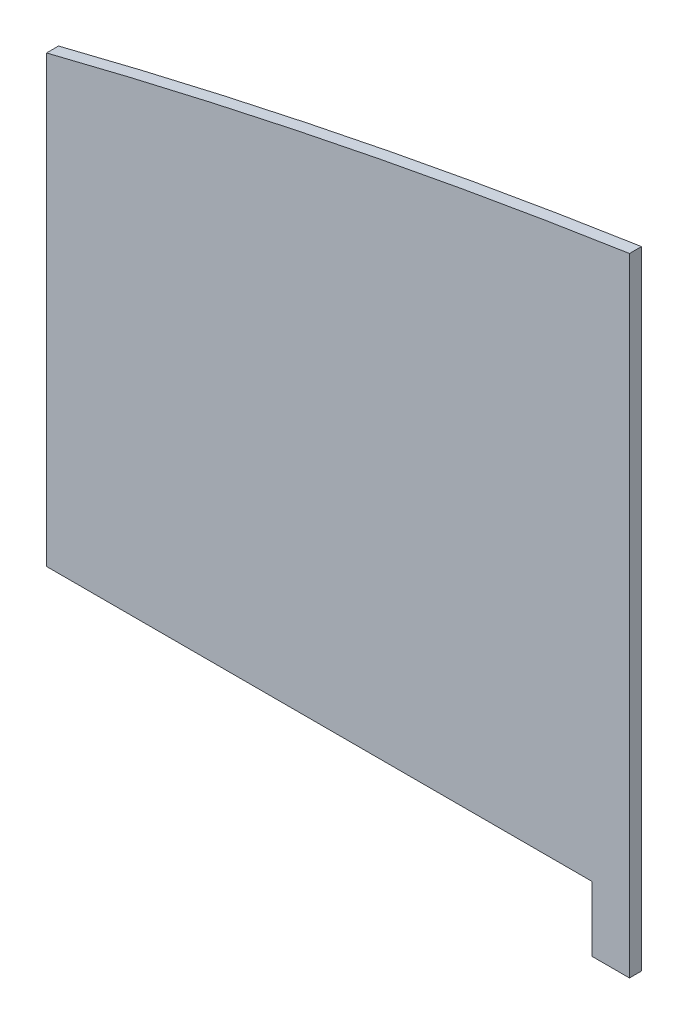
from build123d import *

# Parameters (mm, degrees)
TABAN_FLAN_1_DEPTH = 10


# Sheet-metal steps are written as plain solids
with BuildPart() as part:
    # Çizim1 → Taban-Flanş1 (new body)
    with BuildSketch(Plane.XY):
        with BuildLine():
            Line((0, 0), (0, 370))
            ThreePointArc((0, 370), (241.280287234, 425.036333585), (485, 468))
            Line((485, 468), (485, -54))
            Line((485, -54), (454, -54))
            Line((454, -54), (454, 0))
            Line((454, 0), (0, 0))
        make_face()
    extrude(amount=-TABAN_FLAN_1_DEPTH)


solid = part.part
